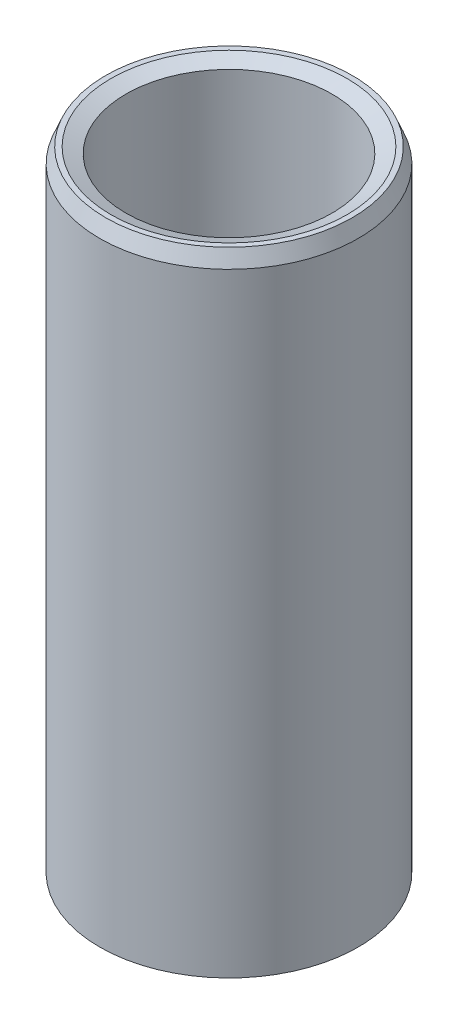
from build123d import *
from OCP.BRepFilletAPI import BRepFilletAPI_MakeChamfer

# Parameters (mm, degrees)
SKETCH1_R           = 30
BOSS_EXTRUDE1_DEPTH = 147.211377728
SKETCH2_R           = 23.925817423
CUT_EXTRUDE1_DEPTH  = 154.203099618
CHAMFER1_SIZE       = 3.451223982
CHAMFER1_SIZE2      = 1.4039111


with BuildPart() as part:
    # Sketch1 → Boss-Extrude1 (new body)
    with BuildSketch(Plane(origin=(0, 0, 0), x_dir=(1, 0, 0), z_dir=(0, 1, 0))):
        Circle(SKETCH1_R)
    extrude(amount=BOSS_EXTRUDE1_DEPTH)

    # Sketch2 → Cut-Extrude1 (cut, through all)
    with BuildSketch(Plane(origin=(0, 0, 0), x_dir=(1, 0, 0), z_dir=(0, 1, 0))):
        Circle(SKETCH2_R)
    extrude(amount=CUT_EXTRUDE1_DEPTH, mode=Mode.SUBTRACT)

    # Chamfer1: one chamfer whose edges measure the first distance from different faces: ONE call of the kernel's chamfer builder (chamfer() names one face for all edges)
    chamfer1_edges_1 = [part.edges().sort_by_distance(p)[0] for p in [
        (-23.925817423, 147.211377728, 0),
    ]]
    chamfer1_side_1 = [part.faces().sort_by_distance(p)[0] for p in [
        (-29.151471863, 147.211377728, 0),
    ]]
    chamfer1_edges_2 = [part.edges().sort_by_distance(p)[0] for p in [
        (-23.925817423, 0, 0),
    ]]
    chamfer1_side_2 = [part.faces().sort_by_distance(p)[0] for p in [
        (-23.925817423, 73.605688864, 0),
    ]]
    chamfer1_edges_3 = [part.edges().sort_by_distance(p)[0] for p in [
        (-30, 0, 0),
    ]]
    chamfer1_side_3 = [part.faces().sort_by_distance(p)[0] for p in [
        (-29.151471863, 0, 0),
    ]]
    chamfer1_edges_4 = [part.edges().sort_by_distance(p)[0] for p in [
        (-30, 147.211377728, 0),
    ]]
    chamfer1_side_4 = [part.faces().sort_by_distance(p)[0] for p in [
        (-30, 73.605688864, 0),
    ]]
    chamfer1 = BRepFilletAPI_MakeChamfer(part.part.solid().wrapped)
    for e in chamfer1_edges_1:
        chamfer1.Add(CHAMFER1_SIZE, CHAMFER1_SIZE2, e.wrapped, chamfer1_side_1[0].wrapped)  # the first distance lies on this face
    for e in chamfer1_edges_2:
        chamfer1.Add(CHAMFER1_SIZE, CHAMFER1_SIZE2, e.wrapped, chamfer1_side_2[0].wrapped)  # the first distance lies on this face
    for e in chamfer1_edges_3:
        chamfer1.Add(CHAMFER1_SIZE, CHAMFER1_SIZE2, e.wrapped, chamfer1_side_3[0].wrapped)  # the first distance lies on this face
    for e in chamfer1_edges_4:
        chamfer1.Add(CHAMFER1_SIZE, CHAMFER1_SIZE2, e.wrapped, chamfer1_side_4[0].wrapped)  # the first distance lies on this face
    add(Compound.cast(chamfer1.Shape()), mode=Mode.REPLACE)


solid = part.part
